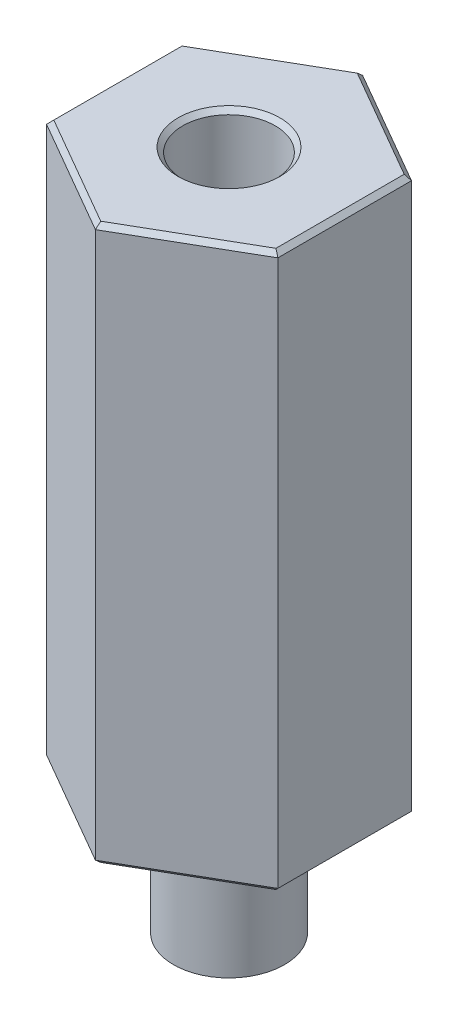
from build123d import *

# Parameters (mm, degrees)
BOSS_EXTRUDE1_DEPTH      = 12
SKETCH2_R                = 1
CUT_EXTRUDE1_DEPTH       = 13.592987467
CHAMFER1_SIZE            = 0.1
BOSS_EXTRUDE2_DEPTH      = 2.7
BOSS_EXTRUDE2_DEPTH_BACK = 2.7
SKETCH3_R                = 1.2


with BuildPart() as part:
    # Sketch1 → Boss-Extrude1 (new body)
    with BuildSketch(Plane(origin=(0, 0, 0), x_dir=(1, 0, 0), z_dir=(0, 1, 0))):
        Polygon((0, 2.886751346), (-2.5, 1.443375673), (-2.5, -1.443375673), (0, -2.886751346), (2.5, -1.443375673), (2.5, 1.443375673), align=None)
    extrude(amount=BOSS_EXTRUDE1_DEPTH)

    # Sketch2 → Cut-Extrude1 (cut, through all)
    with BuildSketch(Plane(origin=(0, 12, 0), x_dir=(1, 0, 0), z_dir=(0, 1, 0))):
        Circle(SKETCH2_R)
    extrude(amount=-CUT_EXTRUDE1_DEPTH, mode=Mode.SUBTRACT)

    # Chamfer1
    chamfer1_edges = [part.edges().sort_by_distance(p)[0] for p in [
        (2.5, 12, 0),
        (1.25, 12, 2.165063509),
        (-1.25, 12, 2.165063509),
        (-2.5, 12, 0),
        (-1.25, 12, -2.165063509),
        (1.25, 12, -2.165063509),
        (-1, 12, 0),
        (-1.25, 0, 2.165063509),
        (1.25, 0, 2.165063509),
        (2.5, 0, 0),
        (1.25, 0, -2.165063509),
        (-1.25, 0, -2.165063509),
        (-2.5, 0, 0),
    ]]
    chamfer(chamfer1_edges, length=CHAMFER1_SIZE)

    # Sketch3 → Boss-Extrude2 (add, two sides: drawn at the far end of the back side and taken through both)
    with BuildSketch(Plane.XZ.offset(-BOSS_EXTRUDE2_DEPTH_BACK)):
        Circle(SKETCH3_R)
    extrude(amount=BOSS_EXTRUDE2_DEPTH + BOSS_EXTRUDE2_DEPTH_BACK)


solid = part.part
